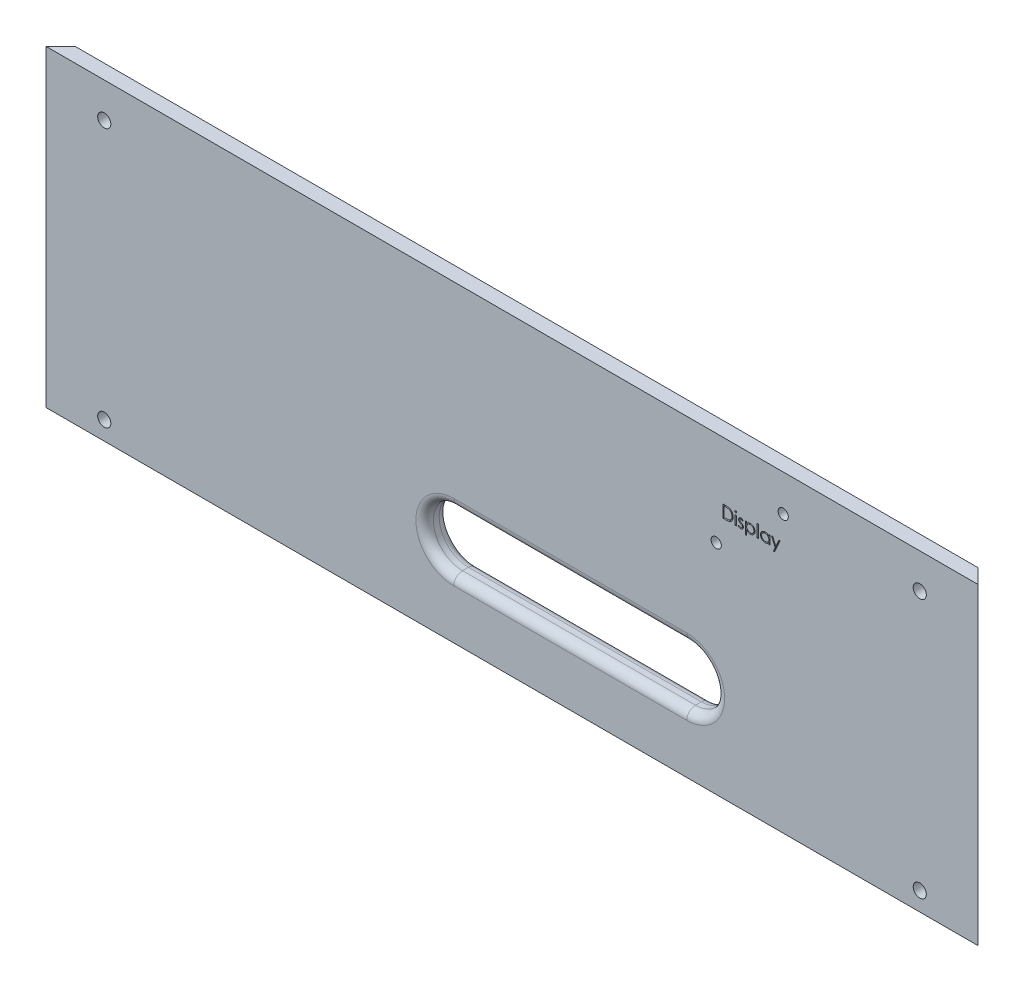
from build123d import *

# Parameters (mm, degrees)
SKETCH1_W           = 320
SKETCH1_H           = 110
SKETCH1_R           = 2.25
BOSS_EXTRUDE1_DEPTH = 5
SKETCH2_W           = 320
SKETCH2_H           = 105
SKETCH2_R           = 2.25
BOSS_EXTRUDE2_DEPTH = 3
CHAMFER1_SIZE       = 8
CHAMFER3_SIZE       = 3
SKETCH3_W           = 7.071067812
SKETCH3_H           = 2.6
CUT_EXTRUDE1_DEPTH  = 357.223151056
SKETCH4_R           = 1.75
CUT_EXTRUDE2_DEPTH  = 339.473041763
SKETCH5_W           = 0.37991453
SKETCH5_H           = 3.093589743
SKETCH5_H_2         = 4.341880342
CUT_EXTRUDE3_DEPTH  = 0.5
CUT_EXTRUDE4_REACH  = 340.473
FILLET1_R           = 3


with BuildPart() as part:
    # Sketch1 → Boss-Extrude1 (new body)
    with BuildSketch(Plane.XY):
        with Locations((160, 55)):
            Rectangle(SKETCH1_W, SKETCH1_H)
        with Locations((20, 9)):
            Circle(SKETCH1_R, mode=Mode.SUBTRACT)
        with Locations(Location((300, 9, 0), (0, 0, 180))):
            Circle(SKETCH1_R, mode=Mode.SUBTRACT)
        with Locations((20, 98)):
            Circle(SKETCH1_R, mode=Mode.SUBTRACT)
        with Locations(Location((300, 98, 0), (0, 0, 180))):
            Circle(SKETCH1_R, mode=Mode.SUBTRACT)
    extrude(amount=-BOSS_EXTRUDE1_DEPTH)

    # Sketch2 → Boss-Extrude2 (add)
    with BuildSketch(Plane(origin=(0, 0, -5), x_dir=(-1, 0, 0), z_dir=(0, 0, -1))):
        with Locations((-160, 57.5)):
            Rectangle(SKETCH2_W, SKETCH2_H)
        with Locations(Location((-20, 9, 0), (0, 0, 180))):
            Circle(SKETCH2_R, mode=Mode.SUBTRACT)
        with Locations((-300, 9)):
            Circle(SKETCH2_R, mode=Mode.SUBTRACT)
        with Locations(Location((-20, 98, 0), (0, 0, 180))):
            Circle(SKETCH2_R, mode=Mode.SUBTRACT)
        with Locations((-300, 98)):
            Circle(SKETCH2_R, mode=Mode.SUBTRACT)
    extrude(amount=BOSS_EXTRUDE2_DEPTH)

    # Chamfer1
    # the kernel refuses this chamfer: 8 mm, written as the material it takes off along each edge
    with BuildSketch(Plane(origin=(320, -15.573463904, -8), x_dir=(-0.9996219169112968, 0, -0.0274958766105862), z_dir=(0, 1, 0)), Plane(origin=(0, 130.573463904, -8), x_dir=(0.9996219169112968, 0, -0.027495876610586275), z_dir=(0, -1, 0))) as chamfer1_piece_1:
        Polygon((CHAMFER1_SIZE * 0.999621916911, CHAMFER1_SIZE * 0.0274958766106), (-CHAMFER1_SIZE * 0.0274958766106, CHAMFER1_SIZE * 0.999621916911), (0, 0), align=None)
    extrude(amount=146.146927807, mode=Mode.SUBTRACT)

    # Chamfer3
    chamfer3_edges = [part.edges().sort_by_distance(p)[0] for p in [
        (160, 110, -8),
    ]]
    chamfer(chamfer3_edges, length=CHAMFER3_SIZE)

    # Sketch3 → Cut-Extrude1 (cut, through all, along a direction that is not the sketch's normal)
    with BuildSketch(Plane(origin=(160, 0, -160), x_dir=(-0.7071067811865452, 0, -0.7071067811865498), z_dir=(0.7071067811865498, 0, -0.7071067811865452))):
        with Locations((-222.738636074, 1.3)):
            Rectangle(SKETCH3_W, SKETCH3_H)
    extrude(amount=-CUT_EXTRUDE1_DEPTH, dir=(1, 0, 0), mode=Mode.SUBTRACT)

    # Sketch4 → Cut-Extrude2 (cut, through all)
    with BuildSketch(Plane.XY):
        with Locations((253.116173953, 97.5)):
            Circle(SKETCH4_R)
        with Locations((230.116173953, 77.5)):
            Circle(SKETCH4_R)
    extrude(amount=-CUT_EXTRUDE2_DEPTH, mode=Mode.SUBTRACT)

    # Sketch5 → Cut-Extrude3 (cut)
    # profile 1 of 8: a face of its own
    with BuildSketch(Plane.XY):
        with BuildLine():
            Line((232.447319816, 85.920185777), (232.447319816, 90.15351911))
            Line((232.447319816, 90.15351911), (233.302127509, 90.15351911))
            add(Edge.make_bspline(
                [(233.302127509, 90.15351911), (233.376475713, 90.152983811), (233.520116058, 90.151949617), (233.727685399, 90.145392315), (233.919738141, 90.133792418), (234.095642646, 90.116895944), (234.255881827, 90.096148941), (234.400007, 90.07014369), (234.528763402, 90.039436093), (234.607950249, 90.013255406), (234.645396739, 90.000874879)],
                knots=[0, 0, 0, 0, 1.314313732, 2.53924729, 3.670748893, 4.714932338, 5.66265055, 6.526160246, 7.303039223, 8, 8, 8, 8], degree=3))
            add(Edge.make_bspline(
                [(234.645396739, 90.000874879), (234.694376091, 89.982211074), (234.791224104, 89.945306695), (234.929118433, 89.875690978), (235.058931015, 89.796814179), (235.181357981, 89.708572326), (235.29360279, 89.608466876), (235.400050437, 89.50075021), (235.496346341, 89.381505266), (235.584530661, 89.253205042), (235.664039506, 89.117360941), (235.733150678, 88.974231809), (235.790547413, 88.82454452), (235.838194458, 88.668715341), (235.875745888, 88.506401626), (235.901365938, 88.337414379), (235.918264183, 88.162421455), (235.919962417, 88.043677103), (235.92082409, 87.983426963)],
                knots=[0, 0, 0, 0, 0.984719456, 1.947108742, 2.898477687, 3.838006223, 4.779231079, 5.722358779, 6.681677486, 7.655904652, 8.64651281, 9.637519902, 10.640069247, 11.656948941, 12.698408672, 13.768548281, 14.867775369, 16, 16, 16, 16], degree=3))
            add(Edge.make_bspline(
                [(235.92082409, 87.983426963), (235.920063339, 87.931101465), (235.918564199, 87.827988606), (235.905103027, 87.676022951), (235.885537382, 87.528565584), (235.855245829, 87.38631869), (235.818473265, 87.248035988), (235.771345196, 87.115191273), (235.717357501, 86.986565904), (235.654401933, 86.863899052), (235.585288068, 86.747683926), (235.511117959, 86.638130668), (235.431970718, 86.536802542), (235.347091619, 86.443392697), (235.257577524, 86.35804195), (235.162842381, 86.280037322), (235.062641739, 86.210905108), (234.957424389, 86.147928701), (234.84412088, 86.0929917), (234.720585118, 86.046509688), (234.586290265, 86.007990448), (234.441565955, 85.975852317), (234.28616213, 85.950358818), (234.119926428, 85.93327261), (233.943114259, 85.92171811), (233.821703147, 85.920706472), (233.759212177, 85.920185777)],
                knots=[0, 0, 0, 0, 1.105936401, 2.179363191, 3.223086493, 4.248585256, 5.251745608, 6.245858792, 7.225916811, 8.198733463, 9.158002045, 10.082870192, 10.993790845, 11.873723703, 12.748670949, 13.606408763, 14.465103618, 15.319838547, 16.196477973, 17.123216899, 18.106603292, 19.147568657, 20.255746949, 21.433717677, 22.679120308, 24, 24, 24, 24], degree=3))
            Line((233.759212177, 85.920185777), (232.447319816, 85.920185777))
        make_face()
        with BuildLine():
            Line((232.827234346, 86.354373811), (233.313151814, 86.354373811))
            add(Edge.make_bspline(
                [(233.313151814, 86.354373811), (233.382975653, 86.35467389), (233.517272466, 86.35525105), (233.710382615, 86.360315572), (233.886827219, 86.368591059), (234.04663133, 86.380172343), (234.189704721, 86.395495335), (234.3163464, 86.412579741), (234.426141236, 86.433864277), (234.492579698, 86.453157342), (234.523281355, 86.462072796)],
                knots=[0, 0, 0, 0, 1.375205317, 2.645023457, 3.804390687, 4.853969522, 5.800190428, 6.637939096, 7.370582563, 8, 8, 8, 8], degree=3))
            add(Edge.make_bspline(
                [(234.523281355, 86.462072796), (234.561923659, 86.475681824), (234.638285298, 86.502574828), (234.748208134, 86.551630284), (234.850723749, 86.609738312), (234.947618732, 86.674329634), (235.037518592, 86.747682417), (235.121488714, 86.828201613), (235.199360035, 86.916297007), (235.270328008, 87.01185926), (235.333838052, 87.114293584), (235.388836586, 87.222592936), (235.437037963, 87.335570696), (235.474870165, 87.454961774), (235.504522348, 87.579698826), (235.525525351, 87.709790626), (235.538606018, 87.845212882), (235.540131769, 87.937320689), (235.54090956, 87.984274986)],
                knots=[0, 0, 0, 0, 0.998632004, 1.973411704, 2.929992603, 3.868527914, 4.809262121, 5.754881198, 6.702106254, 7.672490631, 8.653608572, 9.636854334, 10.631411391, 11.644891563, 12.686317036, 13.754757253, 14.855430412, 16, 16, 16, 16], degree=3))
            add(Edge.make_bspline(
                [(235.54090956, 87.984274986), (235.540288727, 88.033785005), (235.539069094, 88.131047876), (235.523739214, 88.273760431), (235.501336952, 88.41101798), (235.468941446, 88.542829702), (235.427659335, 88.669452756), (235.376140102, 88.790186831), (235.317276667, 88.906307005), (235.247241202, 89.015133143), (235.170538532, 89.118055285), (235.085414812, 89.212343611), (234.993222441, 89.298212908), (234.894966957, 89.377000457), (234.787879227, 89.445536522), (234.674481906, 89.50684327), (234.553111427, 89.558872015), (234.468671309, 89.586544544), (234.425758652, 89.600607785)],
                knots=[0, 0, 0, 0, 1.122418816, 2.205001699, 3.251619955, 4.274784885, 5.280384055, 6.268708349, 7.249350384, 8.229342522, 9.199999885, 10.157847722, 11.105861043, 12.055065948, 13.010012805, 13.98527497, 14.976112212, 16, 16, 16, 16], degree=3))
            add(Edge.make_bspline(
                [(234.425758652, 89.600607785), (234.390257741, 89.610424798), (234.314773066, 89.631298461), (234.191595809, 89.654068197), (234.052966057, 89.674151734), (233.898268323, 89.691155267), (233.727678949, 89.703356123), (233.541066736, 89.712513808), (233.338351024, 89.718690402), (233.197825483, 89.719112171), (233.124890596, 89.719331076)],
                knots=[0, 0, 0, 0, 0.674548936, 1.434276114, 2.292660221, 3.240891867, 4.284742987, 5.42552168, 6.663806718, 8, 8, 8, 8], degree=3))
            Line((233.124890596, 89.719331076), (232.827234346, 89.719331076))
            Line((232.827234346, 89.719331076), (232.827234346, 86.354373811))
        make_face(mode=Mode.SUBTRACT)
    # profile 2 of 8: a face of its own
    with BuildSketch(Plane.XY):
        with BuildLine():
            add(Edge.make_bspline(
                [(236.814640863, 90.316339623), (236.838216074, 90.315246029), (236.884380864, 90.313104562), (236.951138435, 90.294766395), (237.011925488, 90.263682013), (237.065843317, 90.221978018), (237.112109885, 90.172932501), (237.144501792, 90.115769235), (237.165320595, 90.054012595), (237.167834657, 90.010935297), (237.169114688, 89.98900255)],
                knots=[0, 0, 0, 0, 1.055194115, 2.066272739, 3.074728998, 4.095836921, 5.109056067, 6.073838105, 7.019297344, 8, 8, 8, 8], degree=3))
            add(Edge.make_bspline(
                [(237.169114688, 89.98900255), (237.16780579, 89.967639151), (237.165218253, 89.925406238), (237.144517872, 89.864720229), (237.111833832, 89.808351239), (237.065872985, 89.759400951), (237.011917627, 89.717720011), (236.951140524, 89.686629517), (236.884380315, 89.66829297), (236.838215888, 89.66615128), (236.814640863, 89.665057572)],
                knots=[0, 0, 0, 0, 0.96129708, 1.900370562, 2.859976407, 3.87933698, 4.906634145, 5.921202961, 6.938410037, 8, 8, 8, 8], degree=3))
            add(Edge.make_bspline(
                [(236.814640863, 89.665057572), (236.791335426, 89.666109519), (236.745974436, 89.668156997), (236.680216446, 89.686989304), (236.619947702, 89.71773065), (236.565924717, 89.759128036), (236.520893912, 89.808651864), (236.488117842, 89.864685829), (236.467465269, 89.925414997), (236.46487129, 89.967642093), (236.463559133, 89.98900255)],
                knots=[0, 0, 0, 0, 1.054934014, 2.053291228, 3.073705704, 4.106921865, 5.123545215, 6.088680038, 7.033164197, 8, 8, 8, 8], degree=3))
            add(Edge.make_bspline(
                [(236.463559133, 89.98900255), (236.464842542, 90.010932245), (236.467363239, 90.054003548), (236.488133323, 90.115804207), (236.5206209, 90.172629452), (236.565954534, 90.22225077), (236.619939767, 90.263671439), (236.680218496, 90.294406626), (236.745973895, 90.313240532), (236.791335242, 90.315287789), (236.814640863, 90.316339623)],
                knots=[0, 0, 0, 0, 0.98631895, 1.937192651, 2.907499808, 3.917963147, 4.944918757, 5.95915025, 6.951458133, 8, 8, 8, 8], degree=3))
        make_face()
    # profile 3 of 8: a face of its own
    with BuildSketch(Plane.XY):
        with Locations((236.81633691, 87.466980648)):
            Rectangle(SKETCH5_W, SKETCH5_H)
    # profile 4 of 8: a face of its own
    with BuildSketch(Plane.XY):
        with BuildLine():
            Line((239.394328363, 88.627924826), (239.136529218, 88.362493469))
            add(Edge.make_bspline(
                [(239.136529218, 88.362493469), (239.114285466, 88.388272227), (239.071402131, 88.437970638), (239.003388816, 88.504418328), (238.935626934, 88.560222054), (238.869044083, 88.607335738), (238.801965986, 88.642955182), (238.735179809, 88.66895373), (238.668616401, 88.68504258), (238.624122816, 88.687116235), (238.60227441, 88.688134495)],
                knots=[0, 0, 0, 0, 1.26578478, 2.440284043, 3.530471711, 4.527705817, 5.468200915, 6.346673037, 7.188140097, 8, 8, 8, 8], degree=3))
            add(Edge.make_bspline(
                [(238.60227441, 88.688134495), (238.575496291, 88.68683441), (238.522800742, 88.684276028), (238.447295229, 88.658738831), (238.377202568, 88.619539691), (238.316536507, 88.563939594), (238.265146646, 88.500119955), (238.22763486, 88.428762495), (238.204695052, 88.352020576), (238.201786471, 88.298765415), (238.200311269, 88.271754954)],
                knots=[0, 0, 0, 0, 0.99966794, 1.967205029, 2.953328237, 3.988086729, 5.028030931, 6.008226631, 6.989793394, 8, 8, 8, 8], degree=3))
            add(Edge.make_bspline(
                [(238.200311269, 88.271754954), (238.201654823, 88.247308006), (238.204338143, 88.198483024), (238.225198413, 88.126458259), (238.258419281, 88.056236889), (238.289467992, 88.013222707), (238.305466184, 87.991059174)],
                knots=[0, 0, 0, 0, 0.960159726, 1.917612774, 2.927026955, 4, 4, 4, 4], degree=3))
            add(Edge.make_bspline(
                [(238.305466184, 87.991059174), (238.315098219, 87.979224487), (238.335598792, 87.954035845), (238.374071949, 87.919075947), (238.417642023, 87.880441033), (238.47003852, 87.841812669), (238.529004049, 87.801134296), (238.595817278, 87.760007907), (238.66835787, 87.715298555), (238.720291564, 87.686941952), (238.74728643, 87.672202337)],
                knots=[0, 0, 0, 0, 0.66740084, 1.420478572, 2.27185888, 3.217733974, 4.268547843, 5.408967954, 6.65319498, 8, 8, 8, 8], degree=3))
            add(Edge.make_bspline(
                [(238.74728643, 87.672202337), (238.780201899, 87.653763264), (238.843783748, 87.618145047), (238.934126428, 87.562858072), (239.016116468, 87.507907682), (239.090448561, 87.453881551), (239.155692463, 87.399268083), (239.213827684, 87.346160605), (239.263404183, 87.29295449), (239.291167504, 87.255782057), (239.304437872, 87.238014303)],
                knots=[0, 0, 0, 0, 1.27191281, 2.456916733, 3.569705269, 4.599008579, 5.553216877, 6.436649441, 7.252746552, 8, 8, 8, 8], degree=3))
            add(Edge.make_bspline(
                [(239.304437872, 87.238014303), (239.326463938, 87.202132463), (239.370299899, 87.130720942), (239.416332278, 87.013132939), (239.443014706, 86.888418332), (239.446718534, 86.803107932), (239.448601868, 86.759729046)],
                knots=[0, 0, 0, 0, 0.995354457, 1.980940102, 2.973342416, 4, 4, 4, 4], degree=3))
            add(Edge.make_bspline(
                [(239.448601868, 86.759729046), (239.447731574, 86.729165412), (239.446016566, 86.668936432), (239.434093, 86.58023621), (239.413585552, 86.495406793), (239.385653107, 86.413527734), (239.347934865, 86.336167874), (239.303729434, 86.261375458), (239.250661684, 86.19076838), (239.190074973, 86.124439352), (239.123738042, 86.063859448), (239.052973474, 86.010611428), (238.977694127, 85.966373896), (238.8984379, 85.92976724), (238.815024719, 85.900656109), (238.72744154, 85.880502381), (238.635966761, 85.868440089), (238.573761184, 85.866765532), (238.542064742, 85.865912273)],
                knots=[0, 0, 0, 0, 1.032770009, 2.035186124, 3.017557409, 3.978232242, 4.952395191, 5.920591857, 6.910227898, 7.931268572, 8.952309245, 9.941945286, 10.918353717, 11.897095711, 12.887975737, 13.898235213, 14.929059601, 16, 16, 16, 16], degree=3))
            add(Edge.make_bspline(
                [(238.542064742, 85.865912273), (238.499287301, 85.867112967), (238.414326808, 85.869497673), (238.288669719, 85.891881195), (238.165877945, 85.926709909), (238.04688071, 85.974747277), (237.93433922, 86.035405759), (237.83137134, 86.108052654), (237.73761938, 86.190288174), (237.684257278, 86.253319981), (237.657576227, 86.284835884)],
                knots=[0, 0, 0, 0, 1.013940152, 2.01379169, 3.017749504, 4.037548394, 5.051665909, 6.043208538, 7.021604269, 8, 8, 8, 8], degree=3))
            Line((237.657576227, 86.284835884), (237.909439207, 86.571467828))
            add(Edge.make_bspline(
                [(237.909439207, 86.571467828), (237.933354412, 86.545638732), (237.979717651, 86.495565124), (238.053862932, 86.428890921), (238.129312303, 86.373009384), (238.205312353, 86.326269253), (238.282988086, 86.290255194), (238.36190421, 86.264953657), (238.441900208, 86.248692586), (238.495629839, 86.246783616), (238.522560201, 86.245826803)],
                knots=[0, 0, 0, 0, 1.179806542, 2.287233372, 3.337373186, 4.324005949, 5.273901747, 6.200048787, 7.097828587, 8, 8, 8, 8], degree=3))
            add(Edge.make_bspline(
                [(238.522560201, 86.245826803), (238.559230454, 86.247484848), (238.630877978, 86.25072439), (238.733498524, 86.280136492), (238.828250958, 86.326255577), (238.910526814, 86.391672307), (238.980560856, 86.467818571), (239.031273982, 86.553590887), (239.063055641, 86.646471982), (239.06678823, 86.710857719), (239.068687338, 86.7436166)],
                knots=[0, 0, 0, 0, 1.072336372, 2.095165389, 3.102688358, 4.141489647, 5.156069229, 6.117746104, 7.042326257, 8, 8, 8, 8], degree=3))
            add(Edge.make_bspline(
                [(239.068687338, 86.7436166), (239.067373439, 86.770600615), (239.064779321, 86.82387694), (239.044406983, 86.900984495), (239.012218104, 86.97412353), (238.980522958, 87.016928151), (238.964380447, 87.038728779)],
                knots=[0, 0, 0, 0, 1.013901739, 2.00181326, 2.98231254, 4, 4, 4, 4], degree=3))
            add(Edge.make_bspline(
                [(238.964380447, 87.038728779), (238.95467717, 87.049657265), (238.933539928, 87.073463453), (238.89476835, 87.107844263), (238.848344574, 87.144901773), (238.793746472, 87.1840076), (238.73086398, 87.224645913), (238.659442234, 87.266603511), (238.580459661, 87.311873236), (238.524615183, 87.3418932), (238.495423449, 87.357585617)],
                knots=[0, 0, 0, 0, 0.615000592, 1.339693406, 2.178160186, 3.116406724, 4.166410947, 5.330106347, 6.604359322, 8, 8, 8, 8], degree=3))
            add(Edge.make_bspline(
                [(238.495423449, 87.357585617), (238.463919417, 87.375171043), (238.402823047, 87.409274796), (238.316284895, 87.46239234), (238.238213333, 87.516418473), (238.166729781, 87.568322573), (238.103639803, 87.620841239), (238.049191941, 87.674032772), (238.001242528, 87.725751993), (237.974696611, 87.762397294), (237.962016665, 87.779901322)],
                knots=[0, 0, 0, 0, 1.262093308, 2.447601706, 3.550203992, 4.582594899, 5.537233252, 6.418365656, 7.244515135, 8, 8, 8, 8], degree=3))
            add(Edge.make_bspline(
                [(237.962016665, 87.779901322), (237.940087273, 87.815153637), (237.896220825, 87.885670587), (237.853627213, 88.003369926), (237.824349445, 88.127279662), (237.821733982, 88.212777095), (237.820396739, 88.256490531)],
                knots=[0, 0, 0, 0, 0.985009483, 1.970363186, 2.962279964, 4, 4, 4, 4], degree=3))
            add(Edge.make_bspline(
                [(237.820396739, 88.256490531), (237.821042861, 88.285066013), (237.822307414, 88.340992278), (237.832399743, 88.423165899), (237.850774479, 88.501238428), (237.873821862, 88.576382348), (237.905853686, 88.647142023), (237.944130162, 88.71446106), (237.989109238, 88.778246408), (238.040929218, 88.837516863), (238.097905827, 88.891351953), (238.159464263, 88.938279817), (238.224220059, 88.978322742), (238.292447385, 89.011905365), (238.364801672, 89.037307037), (238.440777168, 89.054793588), (238.520220088, 89.066471786), (238.574529069, 89.067515707), (238.60227441, 89.068049025)],
                knots=[0, 0, 0, 0, 1.087655834, 2.128696564, 3.144119009, 4.137814668, 5.115653402, 6.093965665, 7.082169637, 8.081268856, 9.086088321, 10.061021666, 11.022561449, 11.980240094, 12.950172527, 13.934149372, 14.944599409, 16, 16, 16, 16], degree=3))
            add(Edge.make_bspline(
                [(238.60227441, 89.068049025), (238.635163859, 89.066713298), (238.701559727, 89.064016789), (238.801169608, 89.042601334), (238.900632793, 89.007364151), (239.000204845, 88.958697469), (239.099156338, 88.895721343), (239.198357679, 88.819606857), (239.298999772, 88.730854764), (239.36184217, 88.663001416), (239.394328363, 88.627924826)],
                knots=[0, 0, 0, 0, 0.845714091, 1.707292901, 2.609013841, 3.555613372, 4.552488639, 5.621697636, 6.770543573, 8, 8, 8, 8], degree=3))
        make_face()
    # profile 5 of 8: a face of its own
    with BuildSketch(Plane.XY):
        with BuildLine():
            Line((240.208430927, 89.01377552), (240.588345457, 89.01377552))
            Line((240.588345457, 89.01377552), (240.588345457, 88.441359655))
            add(Edge.make_bspline(
                [(240.588345457, 88.441359655), (240.628692129, 88.493293866), (240.70709781, 88.594217613), (240.842231742, 88.724834245), (240.984867025, 88.834991993), (241.138674201, 88.921330866), (241.301262854, 88.98642842), (241.471965752, 89.034542612), (241.652231687, 89.062895633), (241.775477873, 89.0663085), (241.838332103, 89.068049025)],
                knots=[0, 0, 0, 0, 1.0828784, 2.104357462, 3.088488658, 4.04616522, 5.001424249, 5.969181776, 6.964304535, 8, 8, 8, 8], degree=3))
            add(Edge.make_bspline(
                [(241.838332103, 89.068049025), (241.893234327, 89.066460704), (242.001751459, 89.063321303), (242.161485079, 89.042066276), (242.315306733, 89.005638209), (242.462346189, 88.953143769), (242.604178658, 88.888246201), (242.738704436, 88.806340834), (242.868018927, 88.711506679), (242.988869937, 88.602368744), (243.100534829, 88.484285032), (243.197110686, 88.357258054), (243.280412894, 88.225465212), (243.347747443, 88.086863348), (243.400492778, 87.942543898), (243.438005769, 87.791923784), (243.460330728, 87.635561456), (243.463326055, 87.529241023), (243.464841184, 87.475460884)],
                knots=[0, 0, 0, 0, 1.041296284, 2.058176809, 3.050446431, 4.034000596, 5.01514041, 6.003636468, 7.015969324, 8.052561599, 9.08815499, 10.094063707, 11.074456064, 12.040834395, 13.011057502, 13.983766392, 14.980127149, 16, 16, 16, 16], degree=3))
            add(Edge.make_bspline(
                [(243.464841184, 87.475460884), (243.46335893, 87.420545711), (243.460435711, 87.312245064), (243.43776318, 87.153208289), (243.401529628, 87.000218799), (243.34944973, 86.853531061), (243.282150025, 86.713246074), (243.200259747, 86.579465004), (243.103635163, 86.452230715), (242.993204275, 86.333270541), (242.873397391, 86.223688515), (242.745336046, 86.127848183), (242.611007632, 86.047364805), (242.471099391, 85.980135892), (242.324413619, 85.929466298), (242.171634702, 85.892917149), (242.01284582, 85.870378283), (241.904833951, 85.867412358), (241.850204432, 85.865912273)],
                knots=[0, 0, 0, 0, 1.038740735, 2.04854663, 3.033179607, 4.009277356, 4.987731542, 5.972001279, 6.972200261, 8.005528982, 9.039189865, 10.040446548, 11.026516639, 11.997840187, 12.972163198, 13.956796175, 14.96660207, 16, 16, 16, 16], degree=3))
            add(Edge.make_bspline(
                [(241.850204432, 85.865912273), (241.788727273, 85.867478373), (241.667291862, 85.870571882), (241.489736584, 85.901922025), (241.318858868, 85.948775271), (241.15655187, 86.017354054), (241.00152985, 86.104748821), (240.854669704, 86.211320213), (240.715191345, 86.336845349), (240.631239801, 86.432073355), (240.588345457, 86.480729313)],
                knots=[0, 0, 0, 0, 1.014726462, 2.004382257, 2.969841629, 3.936926163, 4.907207904, 5.903978561, 6.929055279, 8, 8, 8, 8], degree=3))
            Line((240.588345457, 86.480729313), (240.588345457, 84.780442187))
            Line((240.588345457, 84.780442187), (240.208430927, 84.780442187))
            Line((240.208430927, 84.780442187), (240.208430927, 89.01377552))
        make_face()
        with BuildLine():
            add(Edge.make_bspline(
                [(241.834940009, 88.688134495), (241.791905681, 88.687360087), (241.707182181, 88.685835478), (241.582997688, 88.667724131), (241.463381313, 88.641431815), (241.349538572, 88.601624088), (241.240378303, 88.552760762), (241.136741265, 88.491701567), (241.038700207, 88.419551046), (240.946501799, 88.337691268), (240.863210006, 88.247491407), (240.789473893, 88.151228057), (240.727537438, 88.049023126), (240.676130233, 87.94182864), (240.637010262, 87.828804343), (240.609244773, 87.710593937), (240.591790918, 87.587068038), (240.589506203, 87.502938392), (240.588345457, 87.460196461)],
                knots=[0, 0, 0, 0, 1.05670511, 2.080379991, 3.077984906, 4.06214886, 5.038337365, 6.01289324, 7.01187578, 8.025460281, 9.038092164, 10.024533457, 11.000252242, 11.969694649, 12.940728589, 13.933144304, 14.949937299, 16, 16, 16, 16], degree=3))
            add(Edge.make_bspline(
                [(240.588345457, 87.460196461), (240.590269636, 87.404088934), (240.594039264, 87.294169538), (240.624685414, 87.133563981), (240.674560447, 86.981585312), (240.74535232, 86.839513391), (240.834793672, 86.70890558), (240.942560013, 86.59195599), (241.067676242, 86.489399751), (241.208062274, 86.403014044), (241.358553803, 86.332876097), (241.515532954, 86.282663671), (241.676840953, 86.251733452), (241.785901682, 86.247806347), (241.840876173, 86.245826803)],
                knots=[0, 0, 0, 0, 1.03728447, 2.032128127, 3.01272805, 3.987917167, 4.958271349, 5.931593992, 6.91984656, 7.941419022, 8.973179163, 9.983609215, 10.983593296, 12, 12, 12, 12], degree=3))
            add(Edge.make_bspline(
                [(241.840876173, 86.245826803), (241.894743245, 86.247709277), (242.001659698, 86.251445652), (242.159089045, 86.283786126), (242.312082484, 86.333189156), (242.457443264, 86.405227858), (242.593905959, 86.493511071), (242.717134124, 86.599417015), (242.824790105, 86.722171518), (242.916549848, 86.858857993), (242.990489835, 87.005422505), (243.046043554, 87.157074279), (243.078106305, 87.313278744), (243.08265023, 87.418504549), (243.084926654, 87.471220766)],
                knots=[0, 0, 0, 0, 1.00104056, 1.986885549, 2.97790532, 3.984399681, 4.995088187, 5.994304198, 6.996462723, 8.023150851, 9.048424203, 10.043036403, 11.019596776, 12, 12, 12, 12], degree=3))
            add(Edge.make_bspline(
                [(243.084926654, 87.471220766), (243.083167119, 87.52426442), (243.079661757, 87.629938463), (243.045133435, 87.78568026), (242.993244891, 87.937944765), (242.917578228, 88.082507715), (242.827830026, 88.218910653), (242.719278896, 88.33932344), (242.597581211, 88.444758444), (242.461280984, 88.531862797), (242.31500066, 88.601150967), (242.161010238, 88.651810226), (242.000090833, 88.682258475), (241.890474527, 88.686158592), (241.834940009, 88.688134495)],
                knots=[0, 0, 0, 0, 0.983928682, 1.960191568, 2.949917689, 3.96440592, 4.982380491, 5.975291189, 6.965713506, 7.964880129, 8.970154049, 9.96478489, 10.968906225, 12, 12, 12, 12], degree=3))
        make_face(mode=Mode.SUBTRACT)
    # profile 6 of 8: a face of its own
    with BuildSketch(Plane.XY):
        with Locations((244.360354004, 88.091125948)):
            Rectangle(SKETCH5_W, SKETCH5_H_2)
    # profile 7 of 8: a face of its own
    with BuildSketch(Plane.XY):
        with BuildLine():
            Line((248.566550586, 89.01377552), (248.566550586, 85.920185777))
            Line((248.566550586, 85.920185777), (248.186636056, 85.920185777))
            Line((248.186636056, 85.920185777), (248.186636056, 86.455288608))
            add(Edge.make_bspline(
                [(248.186636056, 86.455288608), (248.143796185, 86.406859766), (248.060193639, 86.312350271), (247.920564858, 86.188879453), (247.772557633, 86.086821864), (247.616890321, 86.004392919), (247.453703494, 85.942474908), (247.283358893, 85.898464982), (247.105787032, 85.870169581), (246.984529422, 85.867344107), (246.923081034, 85.865912273)],
                knots=[0, 0, 0, 0, 1.074387032, 2.096679803, 3.090159297, 4.057316773, 5.018401886, 5.985159533, 6.978961417, 8, 8, 8, 8], degree=3))
            add(Edge.make_bspline(
                [(246.923081034, 85.865912273), (246.868449319, 85.867395599), (246.760713157, 85.870320785), (246.602230368, 85.893014237), (246.44971879, 85.929457942), (246.303034307, 85.980138065), (246.163126093, 86.047364392), (246.028796262, 86.127847616), (245.90074072, 86.223691287), (245.780911335, 86.333259664), (245.670564058, 86.452270744), (245.573728043, 86.579204881), (245.492988603, 86.713513192), (245.425472887, 86.853495197), (245.373467784, 87.000228481), (245.33721396, 87.153205627), (245.314546943, 87.312245759), (245.311622967, 87.420545944), (245.310140329, 87.475460884)],
                knots=[0, 0, 0, 0, 1.033919861, 2.038935746, 3.024066025, 3.998881131, 4.97069526, 5.957263378, 6.95902576, 7.993208707, 9.027059324, 10.027763471, 11.009749337, 11.988697705, 12.965288445, 13.950418724, 14.960734635, 16, 16, 16, 16], degree=3))
            add(Edge.make_bspline(
                [(245.310140329, 87.475460884), (245.311655828, 87.529240792), (245.314651887, 87.635560769), (245.336971496, 87.791926432), (245.37450424, 87.942534233), (245.427176398, 88.086899298), (245.494718572, 88.225196311), (245.576879211, 88.357523084), (245.673664247, 88.484244165), (245.78524573, 88.602379839), (245.906119214, 88.71150382), (246.03542787, 88.806341428), (246.169955077, 88.888246569), (246.31178748, 88.953141726), (246.458825787, 89.005646071), (246.612379003, 89.041971661), (246.771808246, 89.063376993), (246.880049126, 89.066476717), (246.934953363, 89.068049025)],
                knots=[0, 0, 0, 0, 1.020392517, 2.01726096, 2.990465484, 3.961182959, 4.928053699, 5.906110375, 6.912531644, 7.948652711, 8.985773172, 9.998621852, 10.987621588, 11.969261332, 12.953316658, 13.946091881, 14.958173133, 16, 16, 16, 16], degree=3))
            add(Edge.make_bspline(
                [(246.934953363, 89.068049025), (246.998090336, 89.06631003), (247.121898959, 89.062899943), (247.302998551, 89.034521216), (247.474320919, 88.986577546), (247.637188564, 88.921363049), (247.791016632, 88.834702205), (247.934348813, 88.72538549), (248.06868516, 88.59410234), (248.146554655, 88.493263803), (248.186636056, 88.441359655)],
                knots=[0, 0, 0, 0, 1.038897134, 2.037228247, 3.008116434, 3.962042015, 4.918381754, 5.904844433, 6.921570401, 8, 8, 8, 8], degree=3))
            Line((248.186636056, 88.441359655), (248.186636056, 89.01377552))
            Line((248.186636056, 89.01377552), (248.566550586, 89.01377552))
        make_face()
        with BuildLine():
            add(Edge.make_bspline(
                [(246.940041504, 88.688134495), (246.884507019, 88.686158571), (246.77489078, 88.682258412), (246.613970891, 88.65181047), (246.459982286, 88.601150056), (246.313695129, 88.531866233), (246.177420239, 88.444745761), (246.055628846, 88.339370373), (245.947324817, 88.218615128), (245.856237678, 88.083024956), (245.781984411, 87.937666694), (245.729772858, 87.785720945), (245.695338625, 87.629928257), (245.6918207, 87.524261009), (245.690054859, 87.471220766)],
                knots=[0, 0, 0, 0, 1.031046209, 2.035121221, 3.029706178, 4.034933723, 5.034054252, 6.02443088, 7.017295772, 8.038157696, 9.050218397, 10.03989886, 11.016116709, 12, 12, 12, 12], degree=3))
            add(Edge.make_bspline(
                [(245.690054859, 87.471220766), (245.692310492, 87.418497494), (245.696812916, 87.313257606), (245.729168518, 87.157252528), (245.783451794, 87.005270972), (245.857525527, 86.858602913), (245.950279825, 86.722429763), (246.057792767, 86.599372663), (246.181104059, 86.493551922), (246.317692568, 86.404969333), (246.46357078, 86.333410856), (246.61697944, 86.283620035), (246.775034735, 86.251473576), (246.882503749, 86.247718638), (246.93664941, 86.245826803)],
                knots=[0, 0, 0, 0, 0.979072187, 1.954306742, 2.945804271, 3.96968567, 4.997920485, 5.998718438, 6.996577872, 8.005894225, 9.015743152, 10.005417472, 10.995077863, 12, 12, 12, 12], degree=3))
            add(Edge.make_bspline(
                [(246.93664941, 86.245826803), (246.991618037, 86.247834568), (247.100945185, 86.251827816), (247.262342479, 86.282406108), (247.41896972, 86.332926464), (247.56869332, 86.402956836), (247.708170926, 86.489749067), (247.833354073, 86.591357644), (247.939206721, 86.709531971), (248.028944449, 86.839406348), (248.099309, 86.98178181), (248.150563853, 87.133376498), (248.180867148, 87.294195688), (248.184686498, 87.404097772), (248.186636056, 87.460196461)],
                knots=[0, 0, 0, 0, 1.01762866, 2.023962475, 3.030623092, 4.058876274, 5.077231937, 6.066672613, 7.034107872, 8.005628644, 8.981990164, 9.965428785, 10.961468474, 12, 12, 12, 12], degree=3))
            add(Edge.make_bspline(
                [(248.186636056, 87.460196461), (248.185475328, 87.502938408), (248.18319065, 87.587068086), (248.165736532, 87.710593751), (248.137972002, 87.828805019), (248.09884854, 87.941826176), (248.047454319, 88.049032338), (247.985468926, 88.151193267), (247.911802335, 88.247777627), (247.827640407, 88.337455437), (247.735516781, 88.419251253), (247.638035765, 88.49226324), (247.534042424, 88.552242041), (247.425285627, 88.601882436), (247.311576679, 88.641384455), (247.191990311, 88.66773719), (247.067797631, 88.685832054), (246.983075259, 88.687358934), (246.940041504, 88.688134495)],
                knots=[0, 0, 0, 0, 1.050140795, 2.067009409, 3.05949893, 4.030605086, 5.00011959, 5.97591094, 6.962425594, 7.979863591, 8.993523472, 9.986985069, 10.967611495, 11.937549037, 12.921786183, 13.919465291, 14.943216303, 16, 16, 16, 16], degree=3))
        make_face(mode=Mode.SUBTRACT)
    # profile 8 of 8: a face of its own
    with BuildSketch(Plane.XY):
        Polygon((249.109285628, 89.01377552), (249.518880981, 89.01377552), (250.566190009, 86.64439785), (251.629611483, 89.01377552), (252.040054859, 89.01377552), (250.140482209, 84.780442187), (249.730038833, 84.780442187), (250.360120297, 86.183921087), align=None)
    extrude(amount=-CUT_EXTRUDE3_DEPTH, mode=Mode.SUBTRACT)

    # Sketch6 → Cut-Extrude4 (cut, up to next)
    with BuildSketch(Plane.XY, mode=Mode.PRIVATE) as cut_extrude4_sk1:
        with BuildLine():
            Line((140, 42.6), (220, 42.6))
            ThreePointArc((220, 42.6), (230, 32.6), (220, 22.6))
            Line((220, 22.6), (140, 22.6))
            ThreePointArc((140, 22.6), (130, 32.6), (140, 42.6))
        make_face()
    cut_extrude4_tool1 = extrude(cut_extrude4_sk1.sketch, amount=-CUT_EXTRUDE4_REACH, mode=Mode.PRIVATE) & part.part
    add(cut_extrude4_tool1.solids().sort_by_distance((180, 32.6, 0))[0], mode=Mode.SUBTRACT)

    # Fillet1
    fillet1_edges = [part.edges().sort_by_distance(p)[0] for p in [
        (130, 32.6, 0),
        (180, 22.6, 0),
        (230, 32.6, 0),
        (180, 42.6, 0),
        (180, 22.6, -8),
        (130, 32.6, -8),
        (180, 42.6, -8),
        (230, 32.6, -8),
    ]]
    fillet(fillet1_edges, radius=FILLET1_R)


solid = part.part
